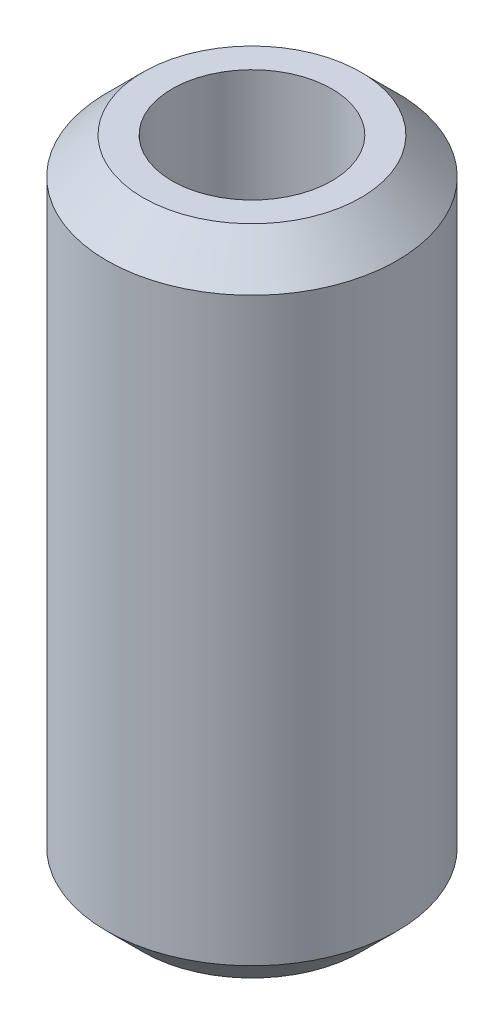
from build123d import *

# Parameters (mm, degrees)
SKETCH_1_R      = 4
SKETCH_1_R_2    = 2.2
EXTRUDE_1_DEPTH = 18
CHAMFER_1_SIZE  = 1


with BuildPart() as part:
    # Эскиз1 → Бобышка-Вытянуть1 (new body)
    with BuildSketch(Plane(origin=(0, 0, 0), x_dir=(1, 0, 0), z_dir=(0, 1, 0))):
        Circle(SKETCH_1_R)
        Circle(SKETCH_1_R_2, mode=Mode.SUBTRACT)
    extrude(amount=EXTRUDE_1_DEPTH)

    # Фаска1
    chamfer_1_edges = [part.edges().sort_by_distance(p)[0] for p in [
        (-4, 0, 0),
        (-4, 18, 0),
    ]]
    chamfer(chamfer_1_edges, length=CHAMFER_1_SIZE)


solid = part.part
